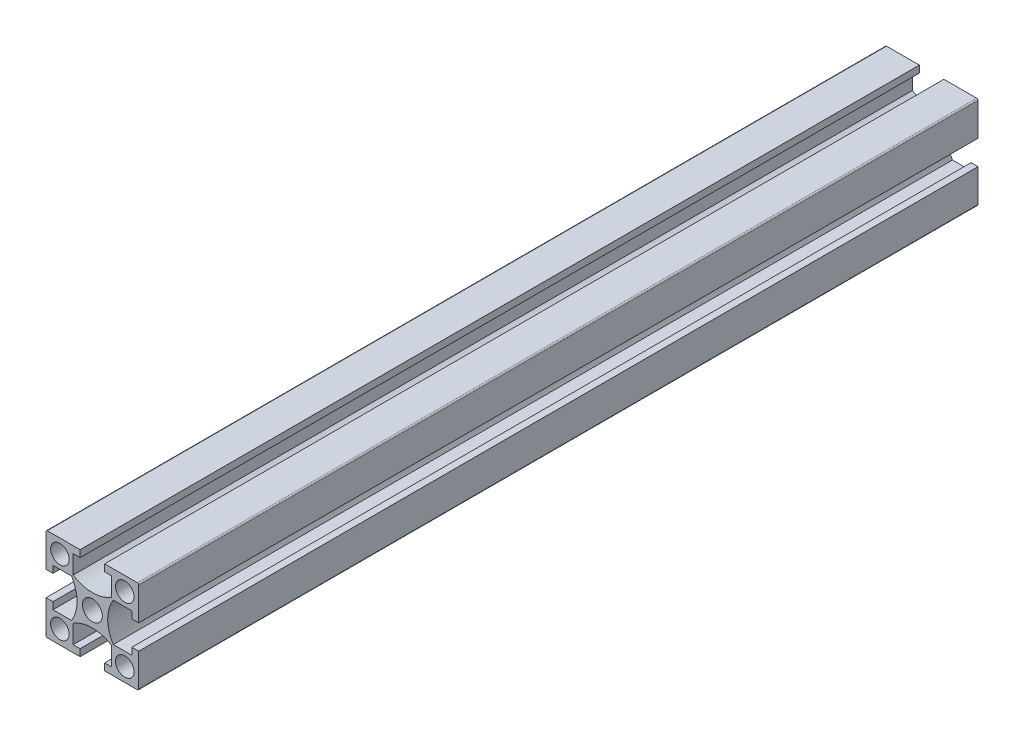
from build123d import *

# Parameters (mm, degrees)
SKETCH_1_W               = 20
SKETCH_1_H               = 20
SKETCH_1_R               = 2
SKETCH_1_R_2             = 2.15
EXTRUDE_1_DEPTH          = 181
CUT_EXTRUDE_1_REACH      = 183.552
PATTERN_CIRCULAR_1_COUNT = 4
FILLET_1_R               = 0.3


with BuildPart() as part:
    # 스케치1 → 보스-돌출1 (new body)
    with BuildSketch(Plane.XY):
        Rectangle(SKETCH_1_W, SKETCH_1_H)
        with Locations((-7, -7)):
            Circle(SKETCH_1_R, mode=Mode.SUBTRACT)
        with Locations((7, -7)):
            Circle(SKETCH_1_R, mode=Mode.SUBTRACT)
        with Locations((-7, 7)):
            Circle(SKETCH_1_R, mode=Mode.SUBTRACT)
        Circle(SKETCH_1_R_2, mode=Mode.SUBTRACT)
        with Locations((7, 7)):
            Circle(SKETCH_1_R, mode=Mode.SUBTRACT)
    extrude(amount=EXTRUDE_1_DEPTH)

    # 스케치1<3> → 컷-돌출1 (cut, up to next)
    with BuildSketch(Plane.XY, mode=Mode.PRIVATE) as cut_extrude_1_sk1:
        with BuildLine():
            Line((-8.5, 2.65), (-10, 2.65))
            Line((-10, 2.65), (-10, -2.65))
            Line((-10, -2.65), (-8.5, -2.65))
            Line((-8.5, -2.65), (-8.5, -4.15))
            Line((-8.5, -4.15), (-4.503166667, -4.15))
            ThreePointArc((-4.503166667, -4.15), (-3.3, 0), (-4.503166667, 4.15))
            Line((-4.503166667, 4.15), (-8.5, 4.15))
            Line((-8.5, 4.15), (-8.5, 2.65))
        make_face()
    cut_extrude_1_tool1 = extrude(cut_extrude_1_sk1.sketch, amount=CUT_EXTRUDE_1_REACH, mode=Mode.PRIVATE) & part.part
    cut_extrude_1 = cut_extrude_1_tool1.solids().sort_by_distance((-6.606913, 0, 0))[0]
    add(cut_extrude_1, mode=Mode.SUBTRACT)

    # 원형 패턴1: 컷-돌출1 ×4 about axis
    pattern_circular_1_axis = Axis((0, 0, 181), (0, 0, -1))
    for i in range(1, PATTERN_CIRCULAR_1_COUNT):
        add(cut_extrude_1.rotate(pattern_circular_1_axis, i * 360 / PATTERN_CIRCULAR_1_COUNT), mode=Mode.SUBTRACT)

    # 필렛1
    fillet_1_edges = [part.edges().sort_by_distance(p)[0] for p in [
        (10, -10, 90.5),
        (-10, -10, 90.5),
        (-10, 10, 90.5),
        (10, 10, 90.5),
    ]]
    fillet(fillet_1_edges, radius=FILLET_1_R)


solid = part.part
